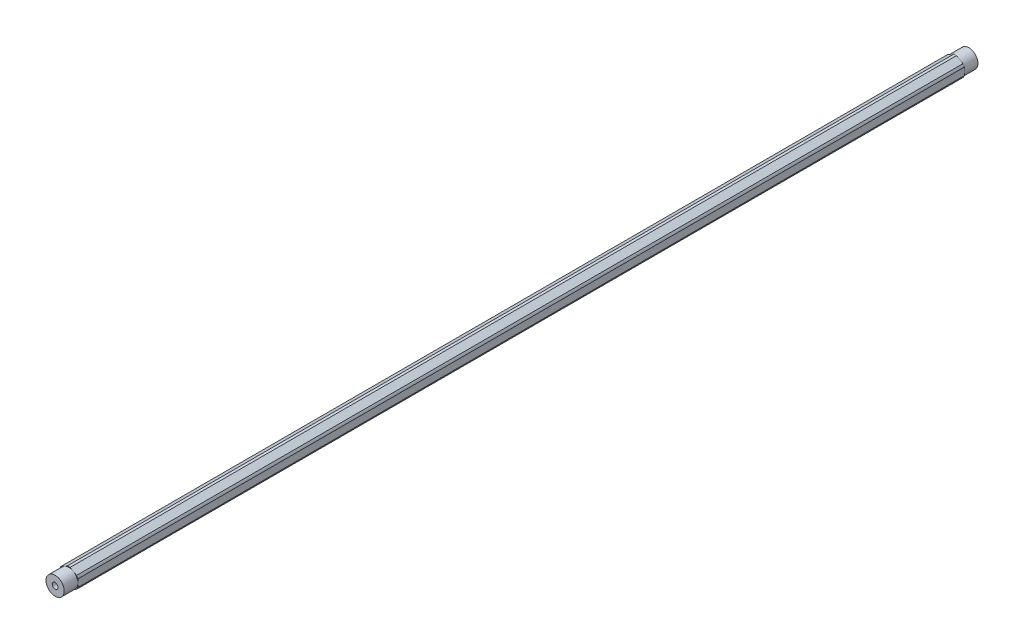
from build123d import *

# Parameters (mm, degrees)
SKETCH2_R                            = 2.0193
BOSS_EXTRUDE1_DEPTH                  = 308.51729
SKETCH7_R                            = 6.35
BOSS_EXTRUDE2_DEPTH                  = 9.525
F_10_32_TAPPED_HOLE2_D               = 4.0386
F_10_32_TAPPED_HOLE2_DEPTH           = 16.34744
F_10_32_TAPPED_HOLE2_TIP             = 1.213317848
F_10_32_TAPPED_HOLE2_ON_FACE_2_D     = 4.0386
F_10_32_TAPPED_HOLE2_ON_FACE_2_DEPTH = 16.34744
F_10_32_TAPPED_HOLE2_ON_FACE_2_TIP   = 1.213317848


with BuildPart() as part:
    # Sketch2 → Boss-Extrude1 (new, symmetric)
    with BuildSketch(Plane.XY):
        with BuildLine():
            ThreePointArc((0.93173274, 6.79441227), (0, 6.858), (-0.93173274, 6.79441227))
            Line((-0.93173274, 6.79441227), (-5.41826726, 4.204110358))
            ThreePointArc((-5.41826726, 4.204110358), (-5.939202219, 3.429), (-6.35, 2.590301913))
            Line((-6.35, 2.590301913), (-6.35, -2.590301913))
            ThreePointArc((-6.35, -2.590301913), (-5.939202219, -3.429), (-5.41826726, -4.204110358))
            Line((-5.41826726, -4.204110358), (-0.93173274, -6.79441227))
            ThreePointArc((-0.93173274, -6.79441227), (0, -6.858), (0.93173274, -6.79441227))
            Line((0.93173274, -6.79441227), (5.41826726, -4.204110358))
            ThreePointArc((5.41826726, -4.204110358), (5.939202219, -3.429), (6.35, -2.590301913))
            Line((6.35, -2.590301913), (6.35, 2.590301913))
            ThreePointArc((6.35, 2.590301913), (5.939202219, 3.429), (5.41826726, 4.204110358))
            Line((5.41826726, 4.204110358), (0.93173274, 6.79441227))
        make_face()
        Circle(SKETCH2_R, mode=Mode.SUBTRACT)
    extrude(amount=BOSS_EXTRUDE1_DEPTH, both=True)

    # Sketch7 → Boss-Extrude2 (add)
    with BuildSketch(Plane.XY.offset(308.51729)):
        Circle(SKETCH7_R)
    boss_extrude2 = extrude(amount=BOSS_EXTRUDE2_DEPTH)

    # Mirror1: Boss-Extrude2 across plane
    add(boss_extrude2.mirror(Plane.XY))

    # #10-32 Tapped Hole2
    with Locations(Plane.XY.offset(318.04229)):
        with Locations((0, 0)):
            Hole(F_10_32_TAPPED_HOLE2_D / 2, depth=F_10_32_TAPPED_HOLE2_DEPTH)
            with Locations((0, 0, -(F_10_32_TAPPED_HOLE2_DEPTH + F_10_32_TAPPED_HOLE2_TIP / 2))):  # 118° drill point
                Cone(0, F_10_32_TAPPED_HOLE2_D / 2, F_10_32_TAPPED_HOLE2_TIP, mode=Mode.SUBTRACT)

    # #10-32 Tapped Hole2 on face 2
    with Locations(Plane(origin=(0, 0, -318.04229), x_dir=(-1, 0, 0), z_dir=(0, 0, -1))):
        with Locations((0, 0)):
            Hole(F_10_32_TAPPED_HOLE2_ON_FACE_2_D / 2, depth=F_10_32_TAPPED_HOLE2_ON_FACE_2_DEPTH)
            with Locations((0, 0, -(F_10_32_TAPPED_HOLE2_ON_FACE_2_DEPTH + F_10_32_TAPPED_HOLE2_ON_FACE_2_TIP / 2))):  # 118° drill point
                Cone(0, F_10_32_TAPPED_HOLE2_ON_FACE_2_D / 2, F_10_32_TAPPED_HOLE2_ON_FACE_2_TIP, mode=Mode.SUBTRACT)


solid = part.part
